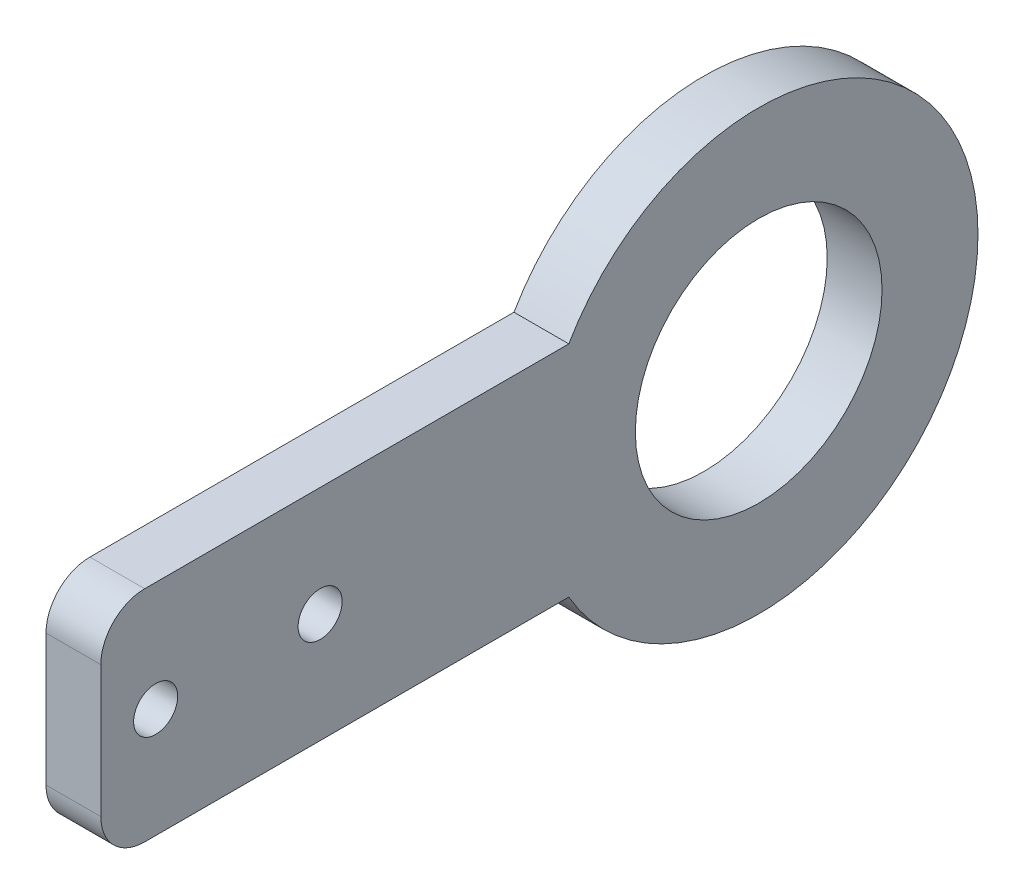
from build123d import *

# Parameters (mm, degrees)
SKETCH1_W              = 88.9
SKETCH1_H              = 25.4
BOSS_EXTRUDE1_DEPTH    = 3.175
FILLET1_R              = 12.7
F_10_CLEARANCE_HOLE1_D = 5.1054
FILLET2_R              = 5.08
SKETCH6_R              = 25.4
BOSS_EXTRUDE2_DEPTH    = 6.35
SKETCH7_R              = 14.2875
CUT_EXTRUDE1_DEPTH     = 63.861792847


with BuildPart() as part:
    # Sketch1 → Boss-Extrude1 (new, symmetric)
    with BuildSketch(Plane(origin=(0, 0, 0), x_dir=(0, 0, -1), z_dir=(1, 0, 0))):
        Rectangle(SKETCH1_W, SKETCH1_H)
    extrude(amount=BOSS_EXTRUDE1_DEPTH, both=True)

    # Fillet1
    fillet1_edges = [part.edges().sort_by_distance(p)[0] for p in [
        (0, -12.7, -44.45),
        (0, 12.7, -44.45),
    ]]
    fillet(fillet1_edges, radius=FILLET1_R - 0.0001)  # a hair under: the kernel refuses the full size

    # #10 Clearance Hole1 (through all)
    with Locations(Plane(origin=(3.175, 6.272913445, 168.827028559), x_dir=(0, 0, -1), z_dir=(1, 0, 0))):
        with Locations((149.777028559, -6.272913445), (130.727028559, -6.272913445)):
            Hole(F_10_CLEARANCE_HOLE1_D / 2)

    # Fillet2
    fillet2_edges = [part.edges().sort_by_distance(p)[0] for p in [
        (0, -12.7, 44.45),
        (0, 12.7, 44.45),
    ]]
    fillet(fillet2_edges, radius=FILLET2_R)

    # Sketch6 → Boss-Extrude2 (add)
    with BuildSketch(Plane(origin=(3.175, 0, 0), x_dir=(0, 0, -1), z_dir=(1, 0, 0))):
        with Locations((31.75, 0)):
            Circle(SKETCH6_R)
    extrude(amount=-BOSS_EXTRUDE2_DEPTH)

    # Sketch7 → Cut-Extrude1 (cut, through all)
    with BuildSketch(Plane(origin=(3.175, 0, 0), x_dir=(0, 0, -1), z_dir=(1, 0, 0))):
        with Locations((31.75, 0)):
            Circle(SKETCH7_R)
    extrude(amount=-CUT_EXTRUDE1_DEPTH, mode=Mode.SUBTRACT)


solid = part.part
